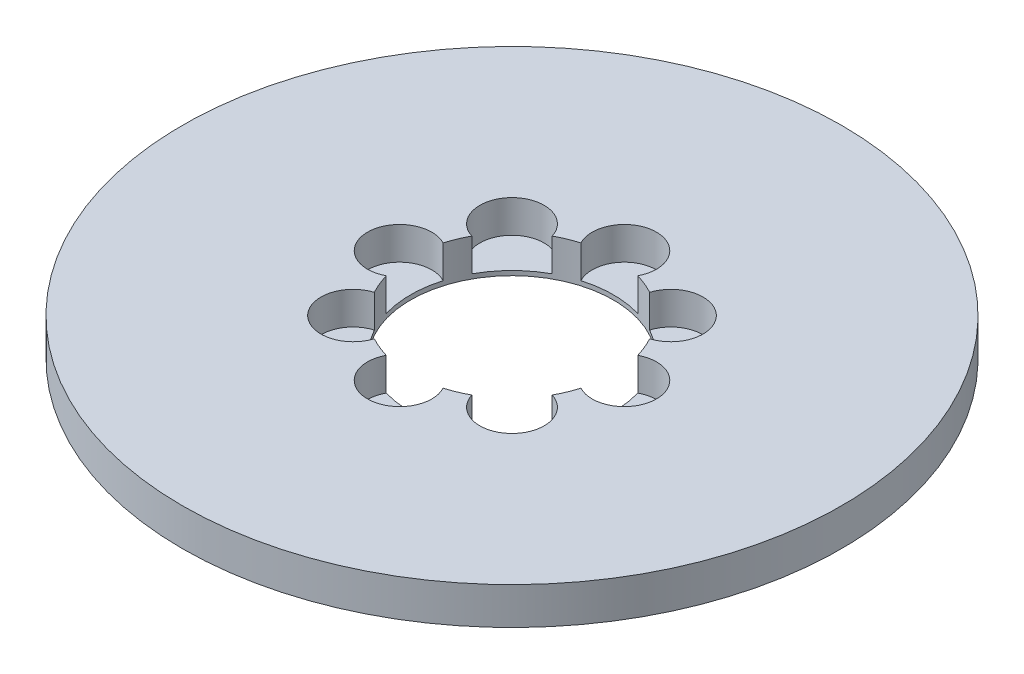
from build123d import *

# Parameters (mm, degrees)
SKETCH1_R           = 97.5
BOSS_EXTRUDE1_DEPTH = 11
SKETCH2_R           = 30
CUT_EXTRUDE1_DEPTH  = 139.32389526
SKETCH3_R           = 9.512436795
CUT_EXTRUDE2_DEPTH  = 9.666318153
CIRPATTERN1_COUNT   = 8


with BuildPart() as part:
    # Sketch1 → Boss-Extrude1 (new body)
    with BuildSketch(Plane(origin=(0, 0, 0), x_dir=(1, 0, 0), z_dir=(0, 1, 0))):
        Circle(SKETCH1_R)
    extrude(amount=BOSS_EXTRUDE1_DEPTH)

    # Sketch2 → Cut-Extrude1 (cut, through all)
    with BuildSketch(Plane(origin=(0, 0, 0), x_dir=(1, 0, 0), z_dir=(0, 1, 0))):
        Circle(SKETCH2_R)
    extrude(amount=CUT_EXTRUDE1_DEPTH, mode=Mode.SUBTRACT)

    # Sketch3 → Cut-Extrude2 (cut)
    with BuildSketch(Plane(origin=(0, 11, 0), x_dir=(1, 0, 0), z_dir=(0, 1, 0))):
        with Locations((-33.234980942, 0)):
            Circle(SKETCH3_R)
    cut_extrude2 = extrude(amount=-CUT_EXTRUDE2_DEPTH, mode=Mode.SUBTRACT)

    # CirPattern1: Cut-Extrude2 ×8 about axis
    cirpattern1_axis = Axis((0, 0, 0), (0, 1, 0))
    for i in range(1, CIRPATTERN1_COUNT):
        add(cut_extrude2.rotate(cirpattern1_axis, i * 360 / CIRPATTERN1_COUNT), mode=Mode.SUBTRACT)


solid = part.part
